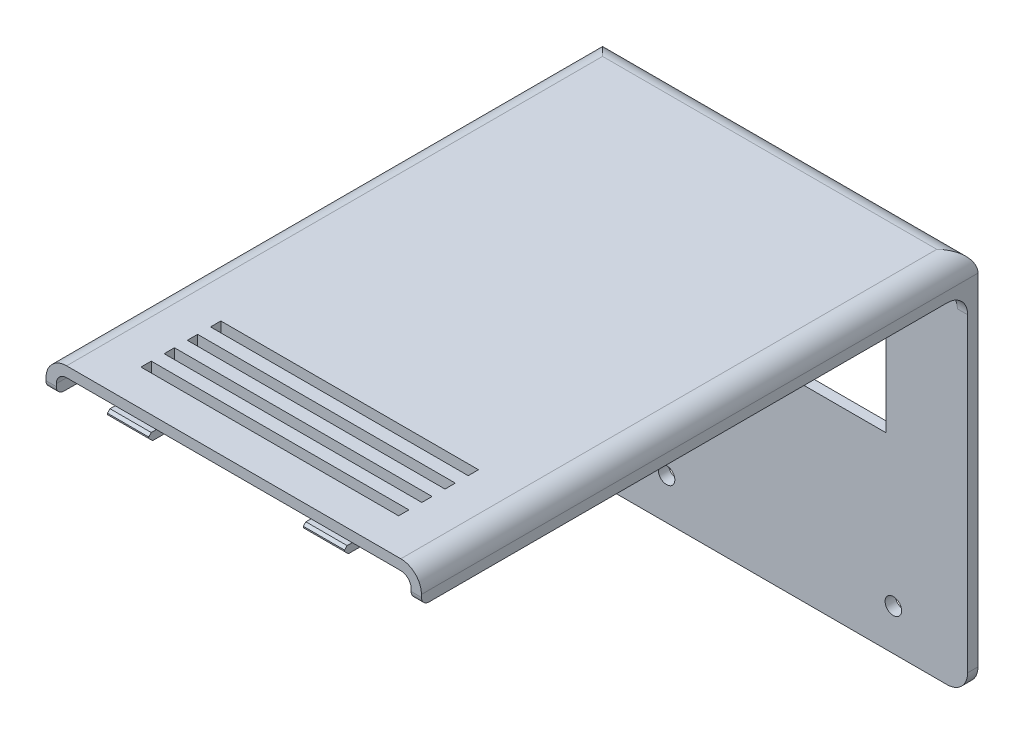
from build123d import *

# Parameters (mm, degrees)
SKETCH1_W                = 68.85
SKETCH1_H                = 107
BOSS_EXTRUDE1_DEPTH      = 2
SKETCH2_W                = 68.85
SKETCH2_H                = 2
BOSS_EXTRUDE2_DEPTH      = 67
CUT_EXTRUDE2_REACH       = 132.855
SKETCH5_W                = 68.85
SKETCH5_H                = 2
BOSS_EXTRUDE3_DEPTH      = 51
SKETCH6_W                = 68.85
SKETCH6_H                = 2
BOSS_EXTRUDE4_DEPTH      = 20.36
BOSS_EXTRUDE5_DEPTH      = 1.5
SKETCH13_W               = 2
SKETCH13_H               = 1.5
BOSS_EXTRUDE8_DEPTH      = 3
CUT_EXTRUDE4_REACH       = 97.75
SKETCH9_R                = 1.75
FILLET1_R                = 1.5
FILLET2_R                = 3
FILLET3_R                = 1.5
FILLET4_R                = 3
CUT_EXTRUDE5_REACH       = 111.975
SKETCH10_R               = 1.75
CHAMFER1_SIZE            = 2
SKETCH11_W               = 2
SKETCH11_H               = 109
BOSS_EXTRUDE6_DEPTH      = 4.5
SKETCH14_W               = 68.85
SKETCH14_H               = 0.5
BOSS_EXTRUDE9_DEPTH      = 2
FILLET5_R                = 2
FILLET6_R                = 4
FILLET8_R                = 4
CUT_EXTRUDE6_DEPTH       = 1
CUT_EXTRUDE7_DEPTH       = 125.986967721
SKETCH17_W               = 68.85
SKETCH17_H               = 2
BOSS_EXTRUDE10_DEPTH     = 8.66
SKETCH18_W               = 2
SKETCH18_H               = 68.16
BOSS_EXTRUDE11_DEPTH     = 2
SKETCH19_W               = 2
SKETCH19_H               = 68.16
BOSS_EXTRUDE12_DEPTH     = 2
FILLET9_R                = 4
FILLET10_R               = 4
FILLET11_R               = 1.5
BOSS_EXTRUDE13_START     = -2
BOSS_EXTRUDE13_OUTLINE_R = 1.6
BOSS_EXTRUDE13_DEPTH     = 2
BOSS_EXTRUDE14_START     = 19
SKETCH21_W               = 7.5
SKETCH21_H               = 1.5
BOSS_EXTRUDE14_DEPTH     = 4
CHAMFER2_SIZE            = 0.5
CHAMFER3_SIZE            = 0.75
SKETCH22_W               = 50
SKETCH22_H               = 2
CUT_EXTRUDE8_DEPTH       = 2
LPATTERN1_COUNT          = 4
LPATTERN1_PITCH          = 4.5


# Read off the part's stored shape, not the designer's step: Boss-Extrude13
with BuildPart() as part:
    # Sketch1 → Boss-Extrude1 (new body)
    with BuildSketch(Plane(origin=(0, 0, 0), x_dir=(1, 0, 0), z_dir=(0, 1, 0))):
        Rectangle(SKETCH1_W, SKETCH1_H)
    extrude(amount=BOSS_EXTRUDE1_DEPTH)

    # Sketch2 → Boss-Extrude2 (add)
    with BuildSketch(Plane.XZ):
        with Locations((0, -52.5)):
            Rectangle(SKETCH2_W, SKETCH2_H)
    extrude(amount=BOSS_EXTRUDE2_DEPTH)

    # Sketch4 → Cut-Extrude2 (cut, up to next)
    with BuildSketch(Plane(origin=(0, 0, -53.5), x_dir=(-1, 0, 0), z_dir=(0, 0, -1)), mode=Mode.PRIVATE) as cut_extrude2_sk1:
        Polygon((-2.25, -15.65), (-2.25, -20.95), (-0.15, -20.95), (-0.15, -15.65), (18.15, -15.65), (18.15, -35.75), (-20.55, -35.75), (-20.55, -15.65), align=None)
    cut_extrude2_tool1 = extrude(cut_extrude2_sk1.sketch, amount=-CUT_EXTRUDE2_REACH, mode=Mode.PRIVATE) & part.part
    add(cut_extrude2_tool1.solids().sort_by_distance((1.2, -25.807418, -53.5))[0], mode=Mode.SUBTRACT)

    # Sketch5 → Boss-Extrude3 (add)
    with BuildSketch(Plane.XY.offset(-51.5)):
        with Locations((0, -66)):
            Rectangle(SKETCH5_W, SKETCH5_H)
    extrude(amount=BOSS_EXTRUDE3_DEPTH)

    # Sketch6 → Boss-Extrude4 (add)
    with BuildSketch(Plane.XZ.offset(67)):
        with Locations((0, -1.5)):
            Rectangle(SKETCH6_W, SKETCH6_H)
    extrude(amount=BOSS_EXTRUDE4_DEPTH)

    # Sketch8 → Boss-Extrude5 (add)
    with BuildSketch(Plane(origin=(0, 2, 0), x_dir=(1, 0, 0), z_dir=(0, 1, 0))):
        Polygon((-36.425, 50.5), (-34.425, 50.5), (-34.425, -53.5), (34.425, -53.5), (34.425, 50.5), (36.425, 50.5), (36.425, -55.5), (-36.425, -55.5), align=None)
    extrude(amount=-BOSS_EXTRUDE5_DEPTH)

    # Sketch13 → Boss-Extrude8 (add)
    with BuildSketch(Plane(origin=(0, 0, -50.5), x_dir=(-1, 0, 0), z_dir=(0, 0, -1))):
        with Locations((35.425, 1.25)):
            Rectangle(SKETCH13_W, SKETCH13_H)
        with Locations((-35.425, 1.25)):
            Rectangle(SKETCH13_W, SKETCH13_H)
    extrude(amount=BOSS_EXTRUDE8_DEPTH)

    # Sketch9 → Cut-Extrude4 (cut, up to next)
    with BuildSketch(Plane.XZ.offset(67), mode=Mode.PRIVATE) as cut_extrude4_sk1:
        with Locations(Location((-25, -23.48, 0), (0, 0, 270))):
            Circle(SKETCH9_R)
    cut_extrude4_tool1 = extrude(cut_extrude4_sk1.sketch, amount=-CUT_EXTRUDE4_REACH, mode=Mode.PRIVATE) & part.part
    # Sketch9 → Cut-Extrude4 (cut, up to next)
    with BuildSketch(Plane.XZ.offset(67), mode=Mode.PRIVATE) as cut_extrude4_sk2:
        with Locations(Location((25, -23.48, 0), (0, 0, 270))):
            Circle(SKETCH9_R)
    cut_extrude4_tool2 = extrude(cut_extrude4_sk2.sketch, amount=-CUT_EXTRUDE4_REACH, mode=Mode.PRIVATE) & part.part
    add(cut_extrude4_tool1.solids().sort_by_distance((-25, -67, -23.48))[0], mode=Mode.SUBTRACT)
    add(cut_extrude4_tool2.solids().sort_by_distance((25, -67, -23.48))[0], mode=Mode.SUBTRACT)

    # Fillet1
    fillet1_edges = [part.edges().sort_by_distance(p)[0] for p in [
        (0, -67, -2.5),
    ]]
    fillet(fillet1_edges, radius=FILLET1_R)

    # Fillet2
    fillet2_edges = [part.edges().sort_by_distance(p)[0] for p in [
        (0, -65, -0.5),
    ]]
    fillet(fillet2_edges, radius=FILLET2_R)

    # Fillet3
    fillet3_edges = [part.edges().sort_by_distance(p)[0] for p in [
        (0, -65, -51.5),
    ]]
    fillet(fillet3_edges, radius=FILLET3_R)

    # Fillet4
    fillet4_edges = [part.edges().sort_by_distance(p)[0] for p in [
        (0, -67, -53.5),
    ]]
    fillet(fillet4_edges, radius=FILLET4_R)

    # Sketch10 → Cut-Extrude5 (cut, up to next)
    with BuildSketch(Plane.XY.offset(-0.5), mode=Mode.PRIVATE) as cut_extrude5_sk1:
        with Locations((-24.425, -79.36)):
            Circle(SKETCH10_R)
    cut_extrude5_tool1 = extrude(cut_extrude5_sk1.sketch, amount=-CUT_EXTRUDE5_REACH, mode=Mode.PRIVATE) & part.part
    # Sketch10 → Cut-Extrude5 (cut, up to next)
    with BuildSketch(Plane.XY.offset(-0.5), mode=Mode.PRIVATE) as cut_extrude5_sk2:
        with Locations((24.425, -79.36)):
            Circle(SKETCH10_R)
    cut_extrude5_tool2 = extrude(cut_extrude5_sk2.sketch, amount=-CUT_EXTRUDE5_REACH, mode=Mode.PRIVATE) & part.part
    add(cut_extrude5_tool1.solids().sort_by_distance((-24.425, -79.36, -0.5))[0], mode=Mode.SUBTRACT)
    add(cut_extrude5_tool2.solids().sort_by_distance((24.425, -79.36, -0.5))[0], mode=Mode.SUBTRACT)

    # Chamfer1
    chamfer1_edges = [part.edges().sort_by_distance(p)[0] for p in [
        (-34.425, -87.36, -1.5),
        (34.425, -87.36, -1.5),
    ]]
    chamfer(chamfer1_edges, length=CHAMFER1_SIZE)

    # Sketch11 → Boss-Extrude6 (add)
    with BuildSketch(Plane.XZ.offset(-0.5)):
        with Locations((35.425, 1)):
            Rectangle(SKETCH11_W, SKETCH11_H)
        with Locations((-35.425, 1)):
            Rectangle(SKETCH11_W, SKETCH11_H)
    extrude(amount=BOSS_EXTRUDE6_DEPTH)

    # Sketch14 → Boss-Extrude9 (add)
    with BuildSketch(Plane.XY.offset(53.5)):
        with Locations((0, 0.25)):
            Rectangle(SKETCH14_W, SKETCH14_H)
    extrude(amount=BOSS_EXTRUDE9_DEPTH)

    # Fillet5
    fillet5_edges = [part.edges().sort_by_distance(p)[0] for p in [
        (0, 0, -51.5),
        (34.425, 0, 2),
        (-34.425, 0, 2),
    ]]
    fillet(fillet5_edges, radius=FILLET5_R)

    # Fillet6
    fillet6_edges = [part.edges().sort_by_distance(p)[0] for p in [
        (0, 2, -53.5),
    ]]
    fillet(fillet6_edges, radius=FILLET6_R)

    # Fillet8
    # the kernel refuses this fillet: 4 mm, written as the material it takes off along each edge
    with BuildSketch(Plane(origin=(-36.425, 2, 65.5), x_dir=(1, 0, 0), z_dir=(0, 0, -1))) as fillet8_piece_1:
        with BuildLine():
            CenterArc((FILLET8_R, FILLET8_R), FILLET8_R, 180, 90)
            Line((0, FILLET8_R), (0, 0))
            Line((0, 0), (FILLET8_R, 0))
        make_face()
    extrude(amount=125, mode=Mode.SUBTRACT)
    with BuildSketch(Plane(origin=(36.425, 2, -59.5), x_dir=(0, -1, 0), z_dir=(0, 0, 1))) as fillet8_piece_2:
        with BuildLine():
            CenterArc((FILLET8_R, -FILLET8_R), FILLET8_R, 90, 90)
            Line((0, -FILLET8_R), (0, 0))
            Line((0, 0), (FILLET8_R, 0))
        make_face()
    extrude(amount=125, mode=Mode.SUBTRACT)

    # Sketch15 → Cut-Extrude6 (cut)
    with BuildSketch(Plane.XY.offset(55.5)):
        with BuildLine():
            Line((-36.425, -2), (-36.425, -4))
            Line((-36.425, -4), (-34.425, -4))
            Line((-34.425, -4), (-34.425, -2))
            ThreePointArc((-34.425, -2), (-33.839213562, -0.585786438), (-32.425, 0))
            Line((-32.425, 0), (32.425, 0))
            ThreePointArc((32.425, 0), (33.839213562, -0.585786438), (34.425, -2))
            Line((34.425, -2), (34.425, -4))
            Line((34.425, -4), (36.425, -4))
            Line((36.425, -4), (36.425, -2))
            ThreePointArc((36.425, -2), (35.253427125, 0.828427125), (32.425, 2))
            Line((32.425, 2), (-32.425, 2))
            ThreePointArc((-32.425, 2), (-35.253427125, 0.828427125), (-36.425, -2))
        make_face()
    extrude(amount=-CUT_EXTRUDE6_DEPTH, mode=Mode.SUBTRACT)

    # Sketch16 → Cut-Extrude7 (cut, through all)
    with BuildSketch(Plane(origin=(34.425, 0, 0), x_dir=(0, 0, -1), z_dir=(1, 0, 0))):
        with BuildLine():
            Line((2.5, -87.36), (0.5, -87.36))
            Line((0.5, -87.36), (0.5, -68))
            ThreePointArc((0.5, -68), (1.378679656, -65.878679656), (3.5, -65))
            Line((3.5, -65), (50, -65))
            ThreePointArc((50, -65), (51.060660172, -64.560660172), (51.5, -63.5))
            Line((51.5, -63.5), (53.5, -63.5))
            Line((53.5, -63.5), (53.5, -64))
            ThreePointArc((53.5, -64), (52.621320344, -66.121320344), (50.5, -67))
            Line((50.5, -67), (4, -67))
            ThreePointArc((4, -67), (2.939339828, -67.439339828), (2.5, -68.5))
            Line((2.5, -68.5), (2.5, -87.36))
        make_face()
    extrude(amount=-CUT_EXTRUDE7_DEPTH, mode=Mode.SUBTRACT)

    # Sketch17 → Boss-Extrude10 (add)
    with BuildSketch(Plane.XZ.offset(63.5)):
        with Locations((0, -52.5)):
            Rectangle(SKETCH17_W, SKETCH17_H)
    extrude(amount=BOSS_EXTRUDE10_DEPTH)

    # Sketch18 → Boss-Extrude11 (add)
    with BuildSketch(Plane(origin=(34.425, 0, 0), x_dir=(0, 0, -1), z_dir=(1, 0, 0))):
        with Locations((52.5, -38.08)):
            Rectangle(SKETCH18_W, SKETCH18_H)
    extrude(amount=BOSS_EXTRUDE11_DEPTH)

    # Sketch19 → Boss-Extrude12 (add)
    with BuildSketch(Plane.ZY.offset(34.425)):
        with Locations((-52.5, -38.08)):
            Rectangle(SKETCH19_W, SKETCH19_H)
    extrude(amount=BOSS_EXTRUDE12_DEPTH)

    # Fillet9
    fillet9_edges = [part.edges().sort_by_distance(p)[0] for p in [
        (36.425, -72.16, -52.5),
        (-36.425, -72.16, -52.5),
    ]]
    fillet(fillet9_edges, radius=FILLET9_R)

    # Fillet10
    fillet10_edges = [part.edges().sort_by_distance(p)[0] for p in [
        (35.425, -4, -51.5),
        (-35.425, -4, -51.5),
    ]]
    fillet(fillet10_edges, radius=FILLET10_R)

    # Fillet11
    fillet11_edges = [part.edges().sort_by_distance(p)[0] for p in [
        (35.425, -4, 54.5),
        (-35.425, -4, 54.5),
    ]]
    fillet(fillet11_edges, radius=FILLET11_R)

    # Boss-Extrude13 outline → Boss-Extrude13 (cut)
    with BuildSketch(Plane(origin=(0, 0, -53.5), x_dir=(-1, 0, 0), z_dir=(0, 0, -1)).offset(BOSS_EXTRUDE13_START)):
        with Locations((22, -64.16)):
            Circle(BOSS_EXTRUDE13_OUTLINE_R)
        with Locations((-22, -64.16)):
            Circle(BOSS_EXTRUDE13_OUTLINE_R)
    extrude(amount=BOSS_EXTRUDE13_DEPTH, mode=Mode.SUBTRACT)

    # Sketch21 → Boss-Extrude14 (add, symmetric)
    with BuildSketch(Plane(origin=(0, 0, 0), x_dir=(0, 0, -1), z_dir=(1, 0, 0)).offset(BOSS_EXTRUDE14_START)):
        with Locations((-52.25, -0.75)):
            Rectangle(SKETCH21_W, SKETCH21_H)
    boss_extrude14 = extrude(amount=BOSS_EXTRUDE14_DEPTH, both=True)

    # Mirror1: Boss-Extrude14 across plane
    add(boss_extrude14.mirror(Plane(origin=(0, 0, 0), x_dir=(0, 0, 1), z_dir=(1, 0, 0))))

    # Chamfer2
    chamfer2_edges = [part.edges().sort_by_distance(p)[0] for p in [
        (19, 0, 56),
        (-19, 0, 56),
    ]]
    chamfer(chamfer2_edges, length=CHAMFER2_SIZE)

    # Chamfer3
    chamfer3_edges = [part.edges().sort_by_distance(p)[0] for p in [
        (19, -1.5, 56),
        (-19, -1.5, 56),
    ]]
    chamfer(chamfer3_edges, length=CHAMFER3_SIZE)

    # Sketch22 → Cut-Extrude8 (cut)
    with BuildSketch(Plane(origin=(0, 2, 0), x_dir=(1, 0, 0), z_dir=(0, 1, 0))):
        with Locations((0, -46.5)):
            Rectangle(SKETCH22_W, SKETCH22_H)
    cut_extrude8 = extrude(amount=-CUT_EXTRUDE8_DEPTH, mode=Mode.SUBTRACT)

    # LPattern1: Cut-Extrude8 ×4
    with Locations(*[(0, 0, -i * LPATTERN1_PITCH) for i in range(1, LPATTERN1_COUNT)]):
        add(cut_extrude8, mode=Mode.SUBTRACT)


solid = part.part
